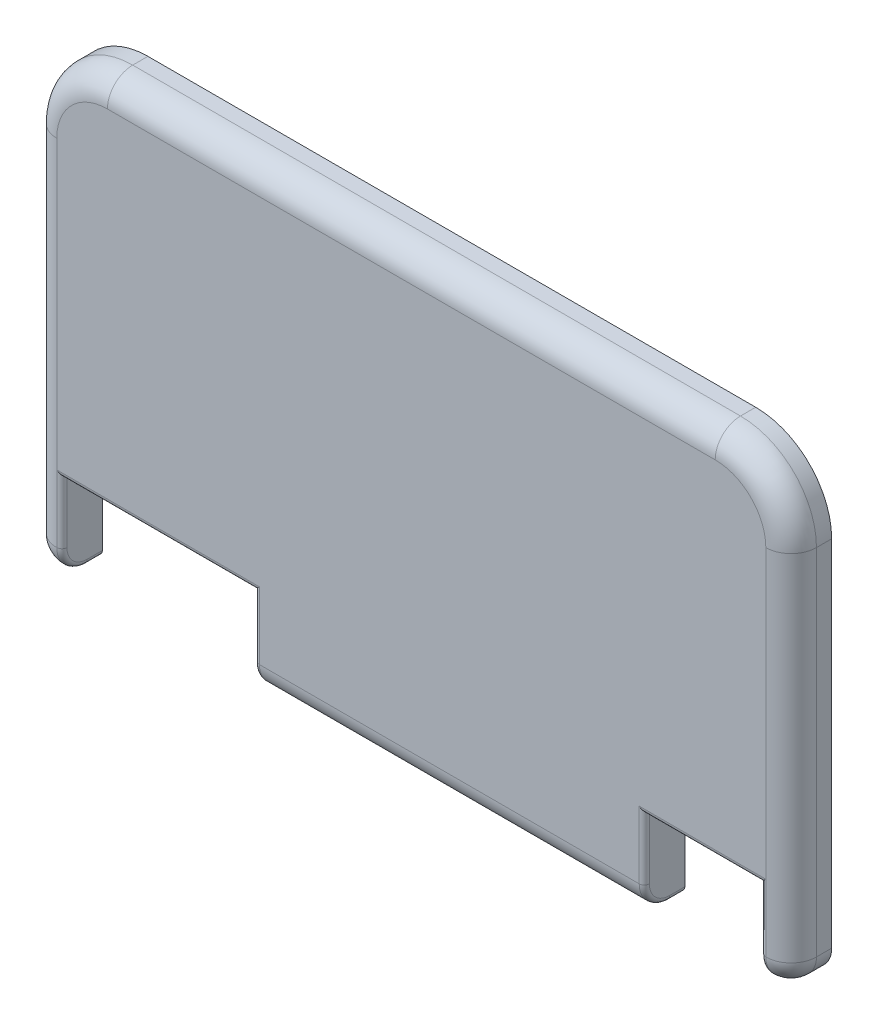
from build123d import *

# Parameters (mm, degrees)
SALIENTE_EXTRUIR1_DEPTH = 8
REDONDEO1_R             = 5
REDONDEO2_R             = 5
REDONDEO3_R             = 1
CROQUIS2_R              = 3.6
CORTAR_EXTRUIR1_DEPTH   = 2


with BuildPart() as part:
    # Croquis1 → Saliente-Extruir1 (new body)
    with BuildSketch(Plane.XY):
        with BuildLine():
            Line((69, -45), (70, -45))
            ThreePointArc((70, -45), (73.535533906, -43.535533906), (75, -40))
            Line((75, -40), (75, 30))
            ThreePointArc((75, 30), (70.606601718, 40.606601718), (60, 45))
            Line((60, 45), (-60, 45))
            ThreePointArc((-60, 45), (-70.606601718, 40.606601718), (-75, 30))
            Line((-75, 30), (-75, -40))
            ThreePointArc((-75, -40), (-73.535533906, -43.535533906), (-70, -45))
            Line((-70, -45), (-69, -45))
            Line((-69, -45), (-69, -27.7))
            Line((-69, -27.7), (-31, -27.7))
            Line((-31, -27.7), (-31, -45))
            Line((-31, -45), (46, -45))
            Line((46, -45), (46, -27.7))
            Line((46, -27.7), (69, -27.7))
            Line((69, -27.7), (69, -45))
        make_face()
    extrude(amount=SALIENTE_EXTRUIR1_DEPTH)

    # Redondeo1
    redondeo1_edges = [part.edges().sort_by_distance(p)[0] for p in [
        (73.535533906, -43.535533906, 8),
        (75, -5, 8),
        (70.606601718, 40.606601718, 8),
        (0, 45, 8),
        (-70.606601718, 40.606601718, 8),
        (-75, -5, 8),
        (-73.535533906, -43.535533906, 8),
        (-69.5, -45, 8),
        (69.5, -45, 8),
    ]]
    fillet(redondeo1_edges, radius=REDONDEO1_R)

    # Redondeo2
    redondeo2_edges = [part.edges().sort_by_distance(p)[0] for p in [
        (7.5, -45, 8),
    ]]
    fillet(redondeo2_edges, radius=REDONDEO2_R)

    # Redondeo3
    redondeo3_edges = [part.edges().sort_by_distance(p)[0] for p in [
        (-69, -33.85, 8),
        (-50, -27.7, 8),
        (69, -33.85, 8),
        (69, -45, 1.5),
        (69, -43.535533906, 6.535533906),
        (-31, -33.85, 8),
        (-69, -45, 1.5),
        (-69, -43.535533906, 6.535533906),
        (57.5, -27.7, 8),
        (46, -33.85, 8),
        (46, -45, 1.5),
        (-31, -45, 1.5),
        (-31, -43.535533906, 6.535533906),
        (46, -43.535533906, 6.535533906),
    ]]
    fillet(redondeo3_edges, radius=REDONDEO3_R - 0.0001)  # a hair under: the kernel refuses the full size

    # Croquis2 → Cortar-Extruir1 (cut)
    with BuildSketch(Plane(origin=(0, 0, 0), x_dir=(-1, 0, 0), z_dir=(0, 0, -1))):
        with Locations((67, -19.7)):
            Circle(CROQUIS2_R)
        with Locations((64.071067812, 34.071067812)):
            Circle(CROQUIS2_R)
        with Locations((-67, -19.7)):
            Circle(CROQUIS2_R)
        with Locations((-64.071067812, 34.071067812)):
            Circle(CROQUIS2_R)
    extrude(amount=-CORTAR_EXTRUIR1_DEPTH, mode=Mode.SUBTRACT)


solid = part.part
